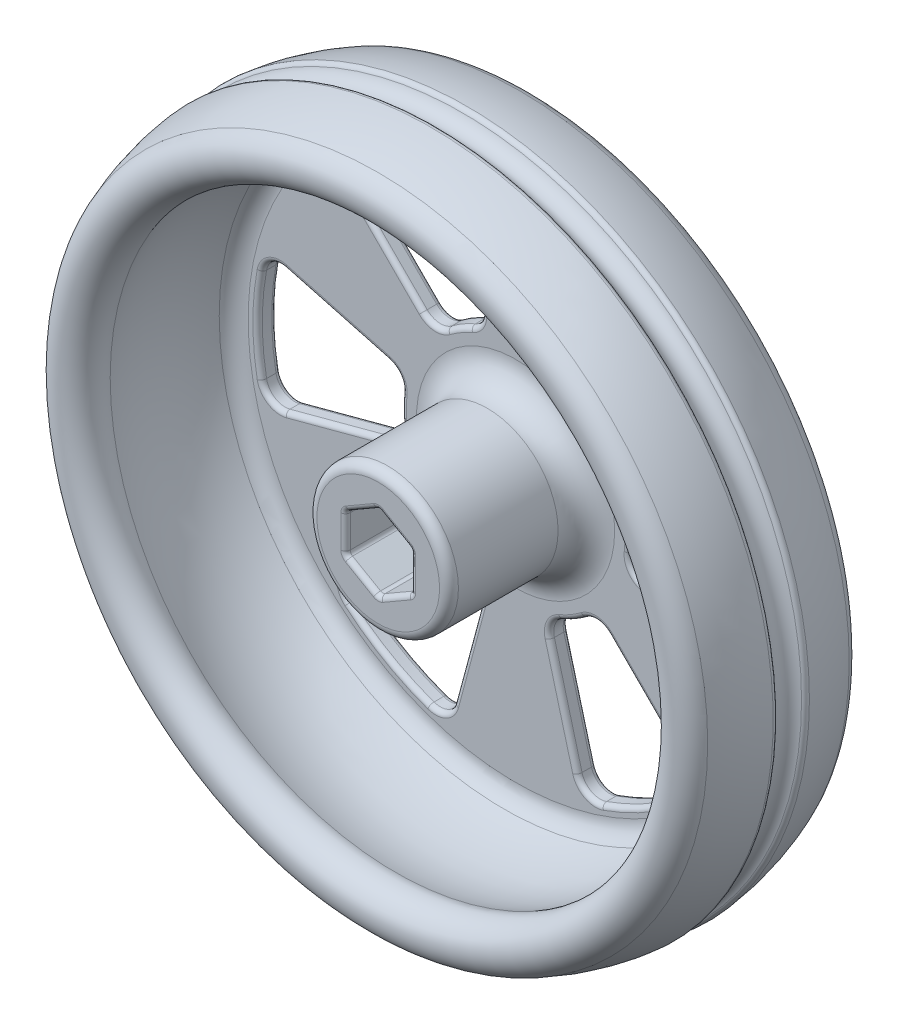
from build123d import *

# Parameters (mm, degrees)
SKETCH1_R                = 7.5
BOSS_EXTRUDE1_DEPTH      = 15
FILLET1_R                = 3
CUT_EXTRUDE1_DEPTH       = 54.97446242
FILLET2_R                = 0.5
FILLET3_R                = 0.5
FILLET4_R                = 1
FILLET5_R                = 0.5
FILLET8_R                = 2
CUT_EXTRUDE2_DEPTH       = 10
FILLET6_R                = 2
FILLET7_R                = 0.5
CIRPATTERN4_COUNT        = 6
FILLET6_OF_CIRPATTERN4_R = 2
FILLET7_OF_CIRPATTERN4_R = 0.5


with BuildPart() as part:
    # Sketch1 → Boss-Extrude1 (new body)
    with BuildSketch(Plane.XY):
        Circle(SKETCH1_R)
        Polygon((0, 4), (-3.464101615, 2), (-3.464101615, -2), (0, -4), (3.464101615, -2), (3.464101615, 2), align=None, mode=Mode.SUBTRACT)
    extrude(amount=BOSS_EXTRUDE1_DEPTH)

    # Sketch3 → Revolve1 (revolve)
    with BuildSketch(Plane(origin=(0, 0, 0), x_dir=(1, 0, 0), z_dir=(0, 1, 0))):
        with BuildLine():
            Line((0, 0), (0, 1.5625))
            Line((0, 1.5625), (-32.60290504, 1.5625))
            ThreePointArc((-32.60290504, 1.5625), (-34.000447451, 1.135390545), (-34.920466999, 1.69e-07))
            ThreePointArc((-34.920466999, 1.69e-07), (-35.855689335, -2.950671532), (-36.324414444, -6.01031221))
            ThreePointArc((-36.324414444, -6.01031221), (-35, -7.5), (-36.324414444, -8.98968779))
            ThreePointArc((-36.324414444, -8.98968779), (-35.855689362, -12.04932835), (-34.92046709, -14.999999944))
            ThreePointArc((-34.92046709, -14.999999944), (-31.665405174, -16.380062081), (-30.285342928, -13.125000211))
            ThreePointArc((-30.285342928, -13.125000211), (-31.358972464, -6.706582928), (-29.613303527, -0.4375))
            Line((-29.613303527, -0.4375), (-7.5, -0.4375))
            Line((-7.5, -0.4375), (-7.5, 0))
            Line((-7.5, 0), (0, 0))
        make_face()
    revolve(axis=Axis((0, 0, 0), (0, 0, 1)))

    # Fillet1
    fillet1_edges = [part.edges().sort_by_distance(p)[0] for p in [
        (-7.5, 0, 0.4375),
    ]]
    fillet(fillet1_edges, radius=FILLET1_R)

    # Sketch4 → Cut-Extrude1 (cut, through all)
    with BuildSketch(Plane.XY):
        Polygon((3.464101615, 2), (0, 4), (-3.464101615, 2), (-3.464101615, -2), (0, -4), (3.464101615, -2), align=None)
    extrude(amount=-CUT_EXTRUDE1_DEPTH, mode=Mode.SUBTRACT)

    # Fillet2
    fillet2_edges = [part.edges().sort_by_distance(p)[0] for p in [
        (-3.464101615, -2, 6.71875),
        (0, -4, 6.71875),
        (3.464101615, -2, 6.71875),
        (3.464101615, 2, 6.71875),
        (0, 4, 6.71875),
        (-3.464101615, 2, 6.71875),
    ]]
    fillet(fillet2_edges, radius=FILLET2_R)

    # Fillet3
    fillet3_edges = [part.edges().sort_by_distance(p)[0] for p in [
        (-3.397114317, 1.961324865, 15),
        (-1.732050808, 3, 15),
        (0, 3.922649731, 15),
        (1.732050808, 3, 15),
        (3.397114317, 1.961324865, 15),
        (3.464101615, 0, 15),
        (3.397114317, -1.961324865, 15),
        (1.732050808, -3, 15),
        (0, -3.922649731, 15),
        (-1.732050808, -3, 15),
        (-3.397114317, -1.961324865, 15),
        (-3.464101615, 0, 15),
        (-3.397114317, 1.961324865, -1.5625),
        (-1.732050808, 3, -1.5625),
        (0, 3.922649731, -1.5625),
        (1.732050808, 3, -1.5625),
        (3.397114317, 1.961324865, -1.5625),
        (3.464101615, 0, -1.5625),
        (3.397114317, -1.961324865, -1.5625),
        (1.732050808, -3, -1.5625),
        (0, -3.922649731, -1.5625),
        (-1.732050808, -3, -1.5625),
        (-3.397114317, -1.961324865, -1.5625),
        (-3.464101615, 0, -1.5625),
    ]]
    fillet(fillet3_edges, radius=FILLET3_R)

    # Fillet4
    fillet4_edges = [part.edges().sort_by_distance(p)[0] for p in [
        (-7.5, 0, 15),
    ]]
    fillet(fillet4_edges, radius=FILLET4_R)

    # Fillet5
    fillet5_edges = [part.edges().sort_by_distance(p)[0] for p in [
        (36.324414444, 0, 6.01031221),
        (36.324414444, 0, 8.98968779),
    ]]
    fillet(fillet5_edges, radius=FILLET5_R)

    # Fillet8
    fillet8_edges = [part.edges().sort_by_distance(p)[0] for p in [
        (29.613303527, 0, 0.4375),
    ]]
    fillet(fillet8_edges, radius=FILLET8_R)

    # Sketch6 → Cut-Extrude2 (cut)
    with BuildSketch(Plane(origin=(0, 0, -1.5625), x_dir=(-1, 0, 0), z_dir=(0, 0, -1))):
        with BuildLine():
            Line((26.421681737, 7.079668284), (11.685408252, 3.131095704))
            ThreePointArc((11.685408252, 3.131095704), (11.994127964, 1.579056903), (12.097624822, 0))
            ThreePointArc((12.097624822, 0), (11.994127964, -1.579056903), (11.685408252, -3.131095704))
            Line((11.685408252, -3.131095704), (26.421681737, -7.079668284))
            ThreePointArc((26.421681737, -7.079668284), (27.119722731, -3.570379231), (27.353737749, 0))
            ThreePointArc((27.353737749, 0), (27.119722731, 3.570379231), (26.421681737, 7.079668284))
        make_face()
    cut_extrude2 = extrude(amount=-CUT_EXTRUDE2_DEPTH, mode=Mode.SUBTRACT)

    # Fillet6
    fillet6_edges = [part.edges().sort_by_distance(p)[0] for p in [
        (-11.685408252, -3.131095704, -0.5625),
        (-11.685408252, 3.131095704, -0.5625),
        (-26.421681737, 7.079668284, -0.5625),
        (-26.421681737, -7.079668284, -0.5625),
    ]]
    fillet(fillet6_edges, radius=FILLET6_R)

    # Fillet7
    fillet7_edges = [part.edges().sort_by_distance(p)[0] for p in [
        (-18.946522392, -5.076705374, 0.4375),
        (-12.340616013, -2.800618626, 0.4375),
        (-12.097624822, 0, 0.4375),
        (-12.340616013, 2.800618626, 0.4375),
        (-12.340616013, 2.800618626, -1.5625),
        (-12.097624822, 0, -1.5625),
        (-12.340616013, -2.800618626, -1.5625),
        (-18.946522392, -5.076705374, -1.5625),
        (-18.946522392, 5.076705374, 0.4375),
        (-18.946522392, 5.076705374, -1.5625),
        (-27.353737749, 0, 0.4375),
        (-27.353737749, 0, -1.5625),
        (-25.998742674, -6.300958297, -1.5625),
        (-25.998742674, 6.300958297, -1.5625),
        (-25.998742674, 6.300958297, 0.4375),
        (-25.998742674, -6.300958297, 0.4375),
    ]]
    fillet(fillet7_edges, radius=FILLET7_R)

    # CirPattern4: Cut-Extrude2 ×6 about axis
    cirpattern4_axis = Axis((0, 0, 14), (0, 0, -1))
    for i in range(1, CIRPATTERN4_COUNT):
        add(cut_extrude2.rotate(cirpattern4_axis, i * 360 / CIRPATTERN4_COUNT), mode=Mode.SUBTRACT)

    # Fillet6 of CirPattern4
    fillet6_of_cirpattern4_edges = [part.edges().sort_by_distance(p)[0] for p in [
        (-8.554312548, 8.554312548, -0.5625),
        (-3.131095704, 11.685408252, -0.5625),
        (-7.079668284, 26.421681737, -0.5625),
        (-19.342013453, 19.342013453, -0.5625),
        (3.131095704, 11.685408252, -0.5625),
        (8.554312548, 8.554312548, -0.5625),
        (19.342013453, 19.342013453, -0.5625),
        (7.079668284, 26.421681737, -0.5625),
        (11.685408252, 3.131095704, -0.5625),
        (11.685408252, -3.131095704, -0.5625),
        (26.421681737, -7.079668284, -0.5625),
        (26.421681737, 7.079668284, -0.5625),
        (8.554312548, -8.554312548, -0.5625),
        (3.131095704, -11.685408252, -0.5625),
        (7.079668284, -26.421681737, -0.5625),
        (19.342013453, -19.342013453, -0.5625),
        (-3.131095704, -11.685408252, -0.5625),
        (-8.554312548, -8.554312548, -0.5625),
        (-19.342013453, -19.342013453, -0.5625),
        (-7.079668284, -26.421681737, -0.5625),
    ]]
    fillet(fillet6_of_cirpattern4_edges, radius=FILLET6_OF_CIRPATTERN4_R)

    # Fillet7 of CirPattern4
    fillet7_of_cirpattern4_edges = [part.edges().sort_by_distance(p)[0] for p in [
        (-13.869817018, 13.869817018, 0.4375),
        (-8.595714883, 9.286977653, 0.4375),
        (-6.048812411, 10.476850421, 0.4375),
        (-3.744901131, 12.087596279, 0.4375),
        (-3.744901131, 12.087596279, -1.5625),
        (-6.048812411, 10.476850421, -1.5625),
        (-8.595714883, 9.286977653, -1.5625),
        (-13.869817018, 13.869817018, -1.5625),
        (-5.076705374, 18.946522392, 0.4375),
        (-5.076705374, 18.946522392, -1.5625),
        (-13.676868874, 23.689031779, 0.4375),
        (-13.676868874, 23.689031779, -1.5625),
        (-18.456161291, 19.365092474, -1.5625),
        (-7.542581384, 25.666050771, -1.5625),
        (-7.542581384, 25.666050771, 0.4375),
        (-18.456161291, 19.365092474, 0.4375),
        (5.076705374, 18.946522392, 0.4375),
        (3.744901131, 12.087596279, 0.4375),
        (6.048812411, 10.476850421, 0.4375),
        (8.595714883, 9.286977653, 0.4375),
        (8.595714883, 9.286977653, -1.5625),
        (6.048812411, 10.476850421, -1.5625),
        (3.744901131, 12.087596279, -1.5625),
        (5.076705374, 18.946522392, -1.5625),
        (13.869817018, 13.869817018, 0.4375),
        (13.869817018, 13.869817018, -1.5625),
        (13.676868874, 23.689031779, 0.4375),
        (13.676868874, 23.689031779, -1.5625),
        (7.542581384, 25.666050771, -1.5625),
        (18.456161291, 19.365092474, -1.5625),
        (18.456161291, 19.365092474, 0.4375),
        (7.542581384, 25.666050771, 0.4375),
        (18.946522392, 5.076705374, 0.4375),
        (12.340616013, 2.800618626, 0.4375),
        (12.097624822, 0, 0.4375),
        (12.340616013, -2.800618626, 0.4375),
        (12.340616013, -2.800618626, -1.5625),
        (12.097624822, 0, -1.5625),
        (12.340616013, 2.800618626, -1.5625),
        (18.946522392, 5.076705374, -1.5625),
        (18.946522392, -5.076705374, 0.4375),
        (18.946522392, -5.076705374, -1.5625),
        (27.353737749, 0, 0.4375),
        (27.353737749, 0, -1.5625),
        (25.998742674, 6.300958297, -1.5625),
        (25.998742674, -6.300958297, -1.5625),
        (25.998742674, -6.300958297, 0.4375),
        (25.998742674, 6.300958297, 0.4375),
        (13.869817018, -13.869817018, 0.4375),
        (8.595714883, -9.286977653, 0.4375),
        (6.048812411, -10.476850421, 0.4375),
        (3.744901131, -12.087596279, 0.4375),
        (3.744901131, -12.087596279, -1.5625),
        (6.048812411, -10.476850421, -1.5625),
        (8.595714883, -9.286977653, -1.5625),
        (13.869817018, -13.869817018, -1.5625),
        (5.076705374, -18.946522392, 0.4375),
        (5.076705374, -18.946522392, -1.5625),
        (13.676868874, -23.689031779, 0.4375),
        (13.676868874, -23.689031779, -1.5625),
        (18.456161291, -19.365092474, -1.5625),
        (7.542581384, -25.666050771, -1.5625),
        (7.542581384, -25.666050771, 0.4375),
        (18.456161291, -19.365092474, 0.4375),
        (-5.076705374, -18.946522392, 0.4375),
        (-3.744901131, -12.087596279, 0.4375),
        (-6.048812411, -10.476850421, 0.4375),
        (-8.595714883, -9.286977653, 0.4375),
        (-8.595714883, -9.286977653, -1.5625),
        (-6.048812411, -10.476850421, -1.5625),
        (-3.744901131, -12.087596279, -1.5625),
        (-5.076705374, -18.946522392, -1.5625),
        (-13.869817018, -13.869817018, 0.4375),
        (-13.869817018, -13.869817018, -1.5625),
        (-13.676868874, -23.689031779, 0.4375),
        (-13.676868874, -23.689031779, -1.5625),
        (-7.542581384, -25.666050771, -1.5625),
        (-18.456161291, -19.365092474, -1.5625),
        (-18.456161291, -19.365092474, 0.4375),
        (-7.542581384, -25.666050771, 0.4375),
    ]]
    fillet(fillet7_of_cirpattern4_edges, radius=FILLET7_OF_CIRPATTERN4_R)


solid = part.part
